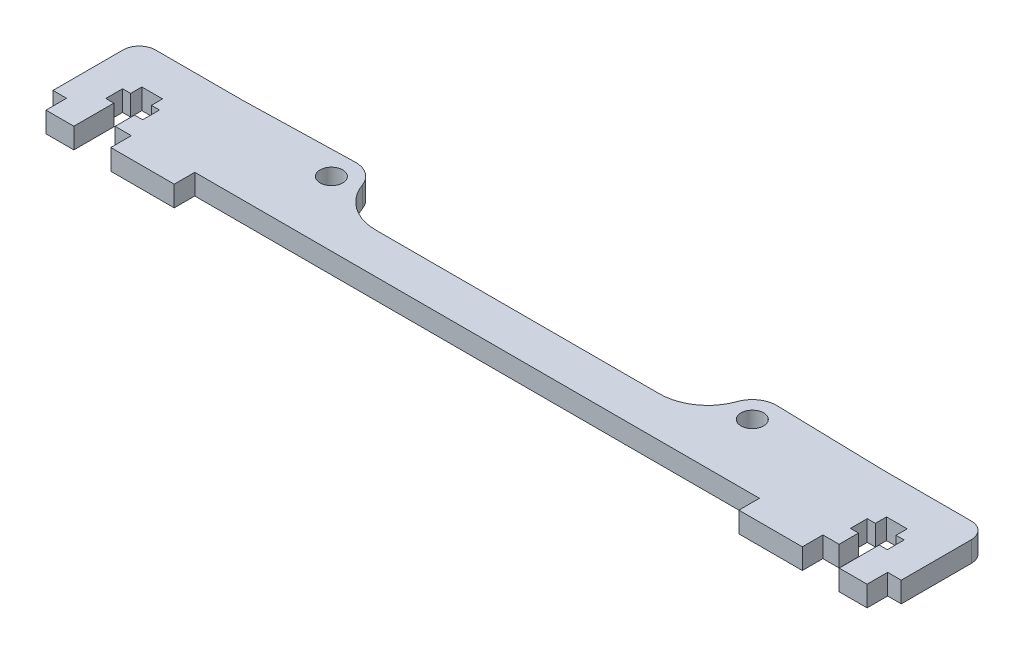
from build123d import *

# Parameters (mm, degrees)
SKETCH1_R           = 1.75
BOSS_EXTRUDE1_DEPTH = 3.175
FILLET1_R           = 7.5
FILLET2_R           = 2.5


with BuildPart() as part:
    # Sketch1 → Boss-Extrude1 (new body)
    with BuildSketch(Plane(origin=(0, 0, 0), x_dir=(1, 0, 0), z_dir=(0, 1, 0))):
        with BuildLine():
            Line((65.5, 3.325), (49.5, 3.325))
            Line((49.5, 3.325), (32.5, 3.75))
            ThreePointArc((32.5, 3.75), (29.848349571, 2.651650429), (28.75, 0))
            Line((28.75, 0), (28.75, -3.75))
            Line((28.75, -3.75), (-28.75, -3.75))
            Line((-28.75, -3.75), (-28.75, 0))
            ThreePointArc((-28.75, 0), (-29.848349571, 2.651650429), (-32.5, 3.75))
            Line((-32.5, 3.75), (-49.5, 3.325))
            Line((-49.5, 3.325), (-65.5, 3.325))
            Line((-65.5, 3.325), (-65.5, -10))
            Line((-65.5, -10), (-63.4, -10))
            Line((-63.4, -10), (-63.4, -13.175))
            Line((-63.4, -13.175), (-59.1, -13.175))
            Line((-59.1, -13.175), (-59.1, -7))
            Line((-59.1, -7), (-60.35, -7))
            Line((-60.35, -7), (-60.35, -4.4))
            Line((-60.35, -4.4), (-59.1, -4.4))
            Line((-59.1, -4.4), (-59.1, -2.675))
            Line((-59.1, -2.675), (-55.9, -2.675))
            Line((-55.9, -2.675), (-55.9, -4.4))
            Line((-55.9, -4.4), (-54.65, -4.4))
            Line((-54.65, -4.4), (-54.65, -7))
            Line((-54.65, -7), (-55.9, -7))
            Line((-55.9, -7), (-55.9, -10))
            Line((-55.9, -10), (-53.4, -10))
            Line((-53.4, -10), (-53.4, -13.175))
            Line((-53.4, -13.175), (-43.6, -13.175))
            Line((-43.6, -13.175), (-43.6, -10))
            Line((-43.6, -10), (43.6, -10))
            Line((43.6, -10), (43.6, -13.175))
            Line((43.6, -13.175), (53.4, -13.175))
            Line((53.4, -13.175), (53.4, -10))
            Line((53.4, -10), (55.9, -10))
            Line((55.9, -10), (55.9, -7))
            Line((55.9, -7), (54.65, -7))
            Line((54.65, -7), (54.65, -4.4))
            Line((54.65, -4.4), (55.9, -4.4))
            Line((55.9, -4.4), (55.9, -2.675))
            Line((55.9, -2.675), (59.1, -2.675))
            Line((59.1, -2.675), (59.1, -4.4))
            Line((59.1, -4.4), (60.35, -4.4))
            Line((60.35, -4.4), (60.35, -7))
            Line((60.35, -7), (59.1, -7))
            Line((59.1, -7), (59.1, -13.175))
            Line((59.1, -13.175), (63.4, -13.175))
            Line((63.4, -13.175), (63.4, -10))
            Line((63.4, -10), (65.5, -10))
            Line((65.5, -10), (65.5, 3.325))
        make_face()
        with Locations((32.5, 0)):
            Circle(SKETCH1_R, mode=Mode.SUBTRACT)
        with Locations((-32.5, 0)):
            Circle(SKETCH1_R, mode=Mode.SUBTRACT)
    extrude(amount=BOSS_EXTRUDE1_DEPTH)

    # Fillet1
    fillet1_edges = [part.edges().sort_by_distance(p)[0] for p in [
        (-28.75, 1.5875, 3.75),
        (28.75, 1.5875, 3.75),
    ]]
    fillet(fillet1_edges, radius=FILLET1_R)

    # Fillet2
    fillet2_edges = [part.edges().sort_by_distance(p)[0] for p in [
        (-65.5, 1.5875, -3.325),
        (65.5, 1.5875, -3.325),
    ]]
    fillet(fillet2_edges, radius=FILLET2_R)


solid = part.part
